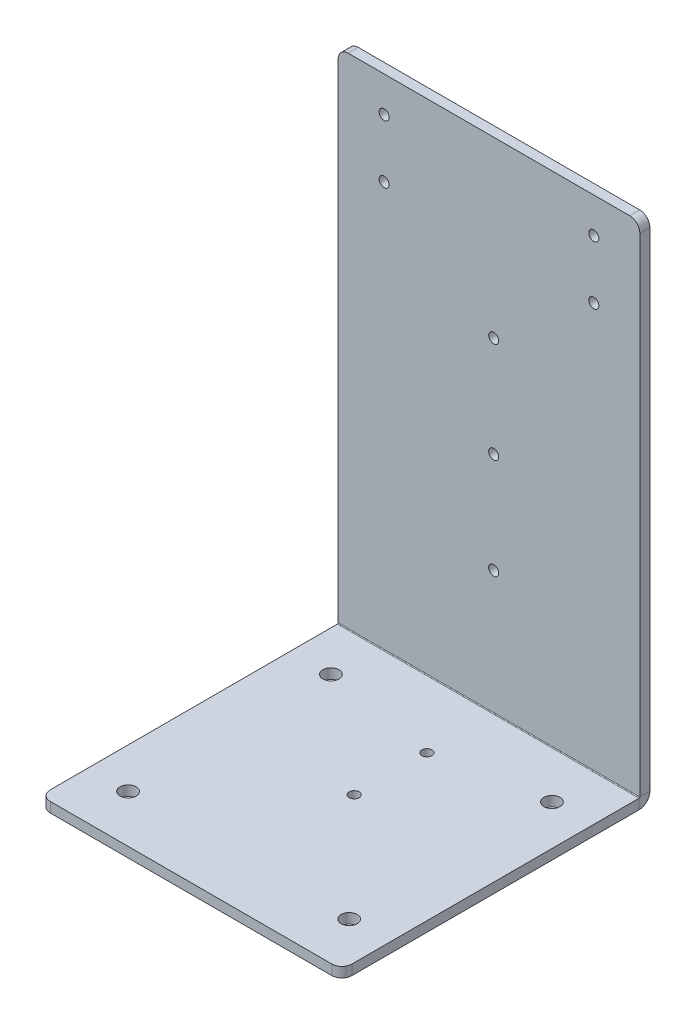
from build123d import *

# Parameters (mm, degrees)
SKETCH3_W              = 300
SKETCH3_H              = 800
BASE_FLANGE1_DEPTH     = 10
SKETCHED_START         = -168.410340007
SKETCHED_BEND1_DEPTH   = 300
SKETCHED_BEND1_2_DEPTH = 300
BREAK_CORNER1_DEPTH    = 10
BREAK_CORNER1_START    = 9.617841009
BREAK_CORNER1_2_DEPTH  = 10
F_10_0MM_DOWEL_HOLE1_D = 10
F_10_0MM_DOWEL_HOLE2_D = 10
F_10_0MM_DOWEL_HOLE3_D = 10
F_16_0MM_DOWEL_HOLE1_D = 16


# Read off the part's stored shape, not the designer's step: Sketched Bend1, Break-Corner1
# Sheet-metal steps are written as plain solids
with BuildPart() as part:
    # Sketch3 → Base-Flange1 (new body)
    with BuildSketch(Plane(origin=(0, 0, 0), x_dir=(1, 0, 0), z_dir=(0, 1, 0))):
        with Locations((-18.410340007, 84.151074095)):
            Rectangle(SKETCH3_W, SKETCH3_H)
    extrude(amount=BASE_FLANGE1_DEPTH)

    # Sketched Bend1 outline → Sketched Bend1 (cut)
    with BuildSketch(Plane.YZ.offset(SKETCHED_START)):
        with BuildLine():
            Line((10, -484.151074095), (10, 9.643138567))
            ThreePointArc((10, 9.643138567), (2.888569702, 13.027572646), (0, 20.354441009))
            Line((0, 20.354441009), (0, -484.151074095))
            Line((0, -484.151074095), (10, -484.151074095))
        make_face()
    extrude(amount=SKETCHED_BEND1_DEPTH, mode=Mode.SUBTRACT)

    # Sketched Bend1 2 outline → Sketched Bend1 2 (add)
    with BuildSketch(Plane.YZ.offset(SKETCHED_START)):
        with BuildLine():
            Line((10.7366, 9.617841009), (506.231084896, 9.617841009))
            Line((506.231084896, 9.617841009), (506.231084896, 19.617841009))
            Line((506.231084896, 19.617841009), (10.7366, 19.617841009))
            ThreePointArc((10.7366, 19.617841009), (10.215745145, 19.833586154), (10, 20.354441009))
            Line((10, 20.354441009), (10, 9.643138567))
            ThreePointArc((10, 9.643138567), (10.368082861, 9.624167262), (10.7366, 9.617841009))
        make_face()
    extrude(amount=SKETCHED_BEND1_2_DEPTH)

    # Break-Corner1 outline → Break-Corner1 (cut)
    with BuildSketch(Plane(origin=(0, 0, 0), x_dir=(1, 0, 0), z_dir=(0, 1, 0))):
        with BuildLine():
            Line((131.589659993, -315.848925905), (131.589659993, -305.848925905))
            ThreePointArc((131.589659993, -305.848925905), (128.660727805, -312.919993717), (121.589659993, -315.848925905))
            Line((121.589659993, -315.848925905), (131.589659993, -315.848925905))
        make_face()
        with BuildLine():
            Line((-168.410340007, -315.848925905), (-158.410340007, -315.848925905))
            ThreePointArc((-158.410340007, -315.848925905), (-165.481407819, -312.919993717), (-168.410340007, -305.848925905))
            Line((-168.410340007, -305.848925905), (-168.410340007, -315.848925905))
        make_face()
    extrude(amount=BREAK_CORNER1_DEPTH, mode=Mode.SUBTRACT)

    # Break-Corner1 2 outline → Break-Corner1 2 (cut)
    with BuildSketch(Plane.XY.offset(BREAK_CORNER1_START)):
        with BuildLine():
            Line((131.589659993, 506.231084896), (121.589659993, 506.231084896))
            ThreePointArc((121.589659993, 506.231084896), (128.660727805, 503.302152708), (131.589659993, 496.231084896))
            Line((131.589659993, 496.231084896), (131.589659993, 506.231084896))
        make_face()
        with BuildLine():
            ThreePointArc((-168.410340007, 496.231084896), (-165.481407819, 503.302152708), (-158.410340007, 506.231084896))
            Line((-158.410340007, 506.231084896), (-168.410340007, 506.231084896))
            Line((-168.410340007, 506.231084896), (-168.410340007, 496.231084896))
        make_face()
    extrude(amount=BREAK_CORNER1_2_DEPTH, mode=Mode.SUBTRACT)

    # Ø10.0mm Dowel Hole1 (through all)
    with Locations(Plane.XY.offset(19.617841009)):
        with Locations((-13.684653237, 333.231084896), (-13.684653237, 233.231084896), (-13.684653237, 133.231084896)):
            Hole(F_10_0MM_DOWEL_HOLE1_D / 2)

    # Ø10.0mm Dowel Hole2 (through all)
    with Locations(Plane(origin=(0, 10, 0), x_dir=(1, 0, 0), z_dir=(0, 1, 0))):
        with Locations((-13.042040007, -86.690456915), (-13.042040007, -159.007394895)):
            Hole(F_10_0MM_DOWEL_HOLE2_D / 2)

    # Ø10.0mm Dowel Hole3 (through all)
    with Locations(Plane.XY.offset(19.617841009)):
        with Locations((85.847745748, 471.172292647), (85.847745748, 413.289877144), (-122.668425763, 413.289877144), (-122.668425763, 471.172292647)):
            Hole(F_10_0MM_DOWEL_HOLE3_D / 2)

    # Ø16.0mm Dowel Hole1 (through all)
    with Locations(Plane(origin=(0, 10, 0), x_dir=(1, 0, 0), z_dir=(0, 1, 0))):
        with Locations((-128.305039397, -66.908688048), (91.484359382, -66.908688048), (91.484359382, -268.558078866), (-128.305039397, -268.558078866)):
            Hole(F_16_0MM_DOWEL_HOLE1_D / 2)


solid = part.part
